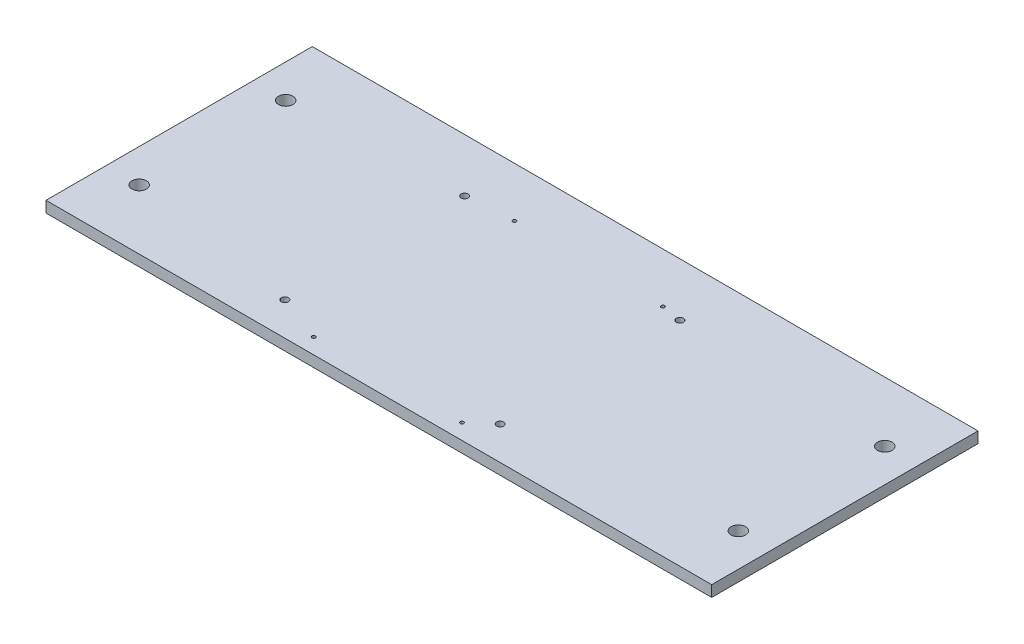
from build123d import *

# Parameters (mm, degrees)
SKETCH1_W               = 300
SKETCH1_H               = 120
BOSS_EXTRUDE1_DEPTH     = 5
TAP_DRILL_FOR_M2_TAP1_D = 1.6
M3_CLEARANCE_HOLE1_D    = 3.2
SKETCH2_R               = 3.2639
CUT_EXTRUDE1_DEPTH      = 324.148572641


with BuildPart() as part:
    # Sketch1 → Boss-Extrude1 (new body)
    with BuildSketch(Plane(origin=(0, 0, 0), x_dir=(1, 0, 0), z_dir=(0, 1, 0))):
        with Locations((150, -60)):
            Rectangle(SKETCH1_W, SKETCH1_H)
    extrude(amount=BOSS_EXTRUDE1_DEPTH)

    # Tap Drill for M2 Tap1 (through all)
    with Locations(Plane(origin=(0, 5, 0), x_dir=(1, 0, 0), z_dir=(0, 1, 0))):
        with Locations((113.641894276, -112.9946), (180.474494276, -112.9946), (180.474494276, -22.4976), (113.641894276, -22.4976)):
            Hole(TAP_DRILL_FOR_M2_TAP1_D / 2)

    # M3 Clearance Hole1 (through all)
    with Locations(Plane(origin=(0, 5, 0), x_dir=(1, 0, 0), z_dir=(0, 1, 0))):
        with Locations((92.641894276, -105), (92.641894276, -24), (189.641894276, -24), (189.641894276, -105)):
            Hole(M3_CLEARANCE_HOLE1_D / 2)

    # Sketch2 → Cut-Extrude1 (cut, through all)
    with BuildSketch(Plane(origin=(0, 5, 0), x_dir=(1, 0, 0), z_dir=(0, 1, 0))):
        with Locations((15, -27)):
            Circle(SKETCH2_R)
        with Locations((285, -27)):
            Circle(SKETCH2_R)
        with Locations((285, -93)):
            Circle(SKETCH2_R)
        with Locations((15, -93)):
            Circle(SKETCH2_R)
    extrude(amount=-CUT_EXTRUDE1_DEPTH, mode=Mode.SUBTRACT)


solid = part.part
